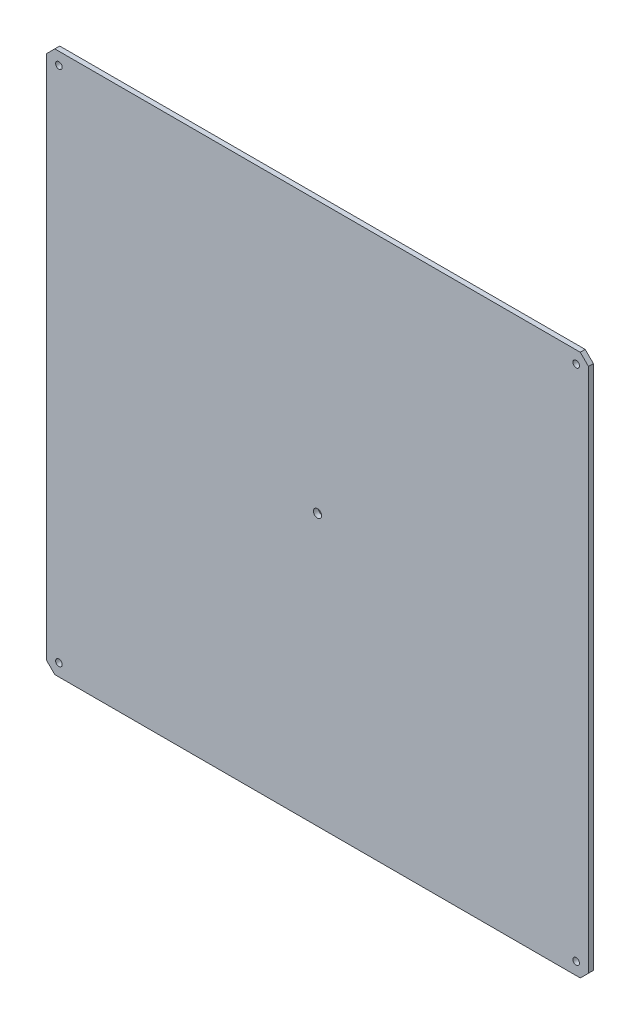
from build123d import *

# Parameters (mm, degrees)
SKETCH1_W           = 330
SKETCH1_H           = 330
SKETCH1_R           = 2
SKETCH1_R_2         = 2.5
BOSS_EXTRUDE1_DEPTH = 3
CHAMFER1_SIZE       = 5


with BuildPart() as part:
    # Sketch1 → Boss-Extrude1 (new body)
    with BuildSketch(Plane.XY):
        Rectangle(SKETCH1_W, SKETCH1_H)
        with Locations((-157.5, 157.5)):
            Circle(SKETCH1_R, mode=Mode.SUBTRACT)
        with Locations((157.5, 157.5)):
            Circle(SKETCH1_R, mode=Mode.SUBTRACT)
        with Locations((157.5, -157.5)):
            Circle(SKETCH1_R, mode=Mode.SUBTRACT)
        with Locations((-157.5, -157.5)):
            Circle(SKETCH1_R, mode=Mode.SUBTRACT)
        Circle(SKETCH1_R_2, mode=Mode.SUBTRACT)
    extrude(amount=BOSS_EXTRUDE1_DEPTH)

    # Chamfer1
    chamfer1_edges = [part.edges().sort_by_distance(p)[0] for p in [
        (-165, -165, 1.5),
        (165, -165, 1.5),
        (165, 165, 1.5),
        (-165, 165, 1.5),
    ]]
    chamfer(chamfer1_edges, length=CHAMFER1_SIZE)


solid = part.part
